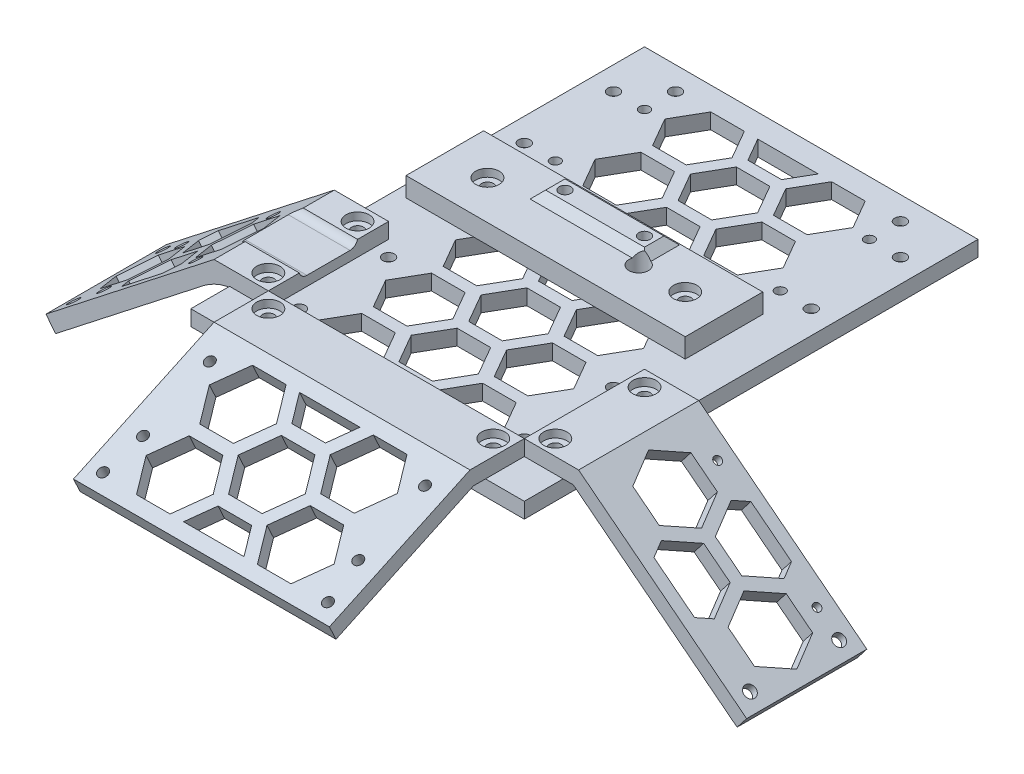
from build123d import *

# Parameters (mm, degrees)
SKETCH2_W            = 72
SKETCH2_H            = 20
BOSS_EXTRUDE1_DEPTH  = 5
SKETCH1_R            = 6
SKETCH1_R_2          = 3
BOSS_EXTRUDE2_DEPTH  = 4
SKETCH3_R            = 1.5
CUT_EXTRUDE1_DEPTH   = 39.431757701
SKETCH4_R            = 3
CUT_EXTRUDE2_DEPTH   = 2
SKETCH6_R            = 1.3
SKETCH6_R_2          = 1.5
BOSS_EXTRUDE4_DEPTH  = 4
SKETCH8_R            = 2.5
CUT_EXTRUDE3_DEPTH   = 74.042795675
SKETCH10_R           = 1.5
CUT_EXTRUDE4_DEPTH   = 5
BOSS_EXTRUDE6_START  = 2
SKETCH11_W           = 25.5
SKETCH11_H           = 5
SKETCH11_R           = 1.5
BOSS_EXTRUDE6_DEPTH  = 2
SKETCH12_R           = 3
CUT_EXTRUDE5_DEPTH   = 2
SKETCH14_R           = 2.983138595
CUT_EXTRUDE6_DEPTH   = 2
SKETCH15_W           = 14
SKETCH15_H           = 31
SKETCH15_R           = 1.5
BOSS_EXTRUDE7_DEPTH  = 4
BOSS_EXTRUDE8_DEPTH  = 31
SKETCH18_R           = 3
CUT_EXTRUDE7_DEPTH   = 2
SKETCH19_R           = 1.5
CUT_EXTRUDE8_DEPTH   = 111.725400051
SKETCH20_R           = 3
CUT_EXTRUDE9_DEPTH   = 2
SKETCH21_W           = 66
SKETCH21_H           = 14
SKETCH21_R           = 1.5
BOSS_EXTRUDE9_DEPTH  = 4
SKETCH22_R           = 3
CUT_EXTRUDE10_DEPTH  = 2
BOSS_EXTRUDE10_DEPTH = 66
SKETCH25_W           = 57.340591448
SKETCH25_H           = 15
CUT_EXTRUDE11_DEPTH  = 1.5
FILLET1_R            = 2
FILLET2_R            = 15
SKETCH28_R           = 1.25
CUT_EXTRUDE12_DEPTH  = 4
CUT_EXTRUDE13_DEPTH  = 4
SKETCH30_W           = 14
SKETCH30_H           = 31
SKETCH30_R           = 1.5
BOSS_EXTRUDE11_DEPTH = 4
BOSS_EXTRUDE12_DEPTH = 31
SKETCH32_R           = 1.5
SKETCH32_R_2         = 1
CUT_EXTRUDE14_DEPTH  = 4
CUT_EXTRUDE15_DEPTH  = 4
SKETCH34_R           = 3
SKETCH34_R_2         = 2.5
CUT_EXTRUDE16_DEPTH  = 2
CUT_EXTRUDE17_DEPTH  = 4
CUT_EXTRUDE18_DEPTH  = 4
SKETCH37_R           = 3
CUT_EXTRUDE19_DEPTH  = 2


with BuildPart() as part:
    # Sketch2 → Boss-Extrude1 (new body)
    with BuildSketch(Plane(origin=(0, 0, 0), x_dir=(1, 0, 0), z_dir=(0, 1, 0))):
        Rectangle(SKETCH2_W, SKETCH2_H)
    extrude(amount=BOSS_EXTRUDE1_DEPTH)

    # Sketch1 → Boss-Extrude2 (add)
    with BuildSketch(Plane(origin=(0, 0, 0), x_dir=(1, 0, 0), z_dir=(0, 1, 0))):
        with Locations(Location((-25, 0, 0), (0, 0, 270))):
            Circle(SKETCH1_R)
        with Locations(Location((26, 0, 0), (0, 0, 270))):
            Circle(SKETCH1_R_2)
    extrude(amount=-BOSS_EXTRUDE2_DEPTH)

    # Sketch3 → Cut-Extrude1 (cut, through all)
    with BuildSketch(Plane.XZ.offset(4)):
        with Locations(Location((-25, 0, 0), (0, 0, 270))):
            Circle(SKETCH3_R)
        with Locations(Location((26, 0, 0), (0, 0, 270))):
            Circle(SKETCH3_R)
    extrude(amount=-CUT_EXTRUDE1_DEPTH, mode=Mode.SUBTRACT)

    # Sketch4 → Cut-Extrude2 (cut)
    with BuildSketch(Plane(origin=(0, 5, 0), x_dir=(1, 0, 0), z_dir=(0, 1, 0))):
        with Locations(Location((-25, 0, 0), (0, 0, 270))):
            Circle(SKETCH4_R)
        with Locations(Location((26, 0, 0), (0, 0, 270))):
            Circle(SKETCH4_R)
    extrude(amount=-CUT_EXTRUDE2_DEPTH, mode=Mode.SUBTRACT)

    # Sketch8 → Cut-Extrude3 (cut, through all)
    with BuildSketch(Plane.XZ):
        with Locations(Location((14, 0, 0), (0, 0, 270))):
            Circle(SKETCH8_R)
    extrude(amount=-CUT_EXTRUDE3_DEPTH, mode=Mode.SUBTRACT)

    # Sketch10 → Cut-Extrude4 (cut)
    with BuildSketch(Plane(origin=(0, 5, 0), x_dir=(1, 0, 0), z_dir=(0, 1, 0))):
        with Locations(Location((-10.25, 5.25, 0), (0, 0, 270))):
            Circle(SKETCH10_R)
        with Locations(Location((10.25, 5.25, 0), (0, 0, 270))):
            Circle(SKETCH10_R)
    extrude(amount=-CUT_EXTRUDE4_DEPTH, mode=Mode.SUBTRACT)

    # Sketch11 → Boss-Extrude6 (add)
    with BuildSketch(Plane(origin=(0, 5, 0), x_dir=(1, 0, 0), z_dir=(0, 1, 0)).offset(BOSS_EXTRUDE6_START)):
        with Locations((0, 5.25)):
            Rectangle(SKETCH11_W, SKETCH11_H)
        with Locations(Location((-10.25, 5.25, 0), (0, 0, 270))):
            Circle(SKETCH11_R, mode=Mode.SUBTRACT)
        with Locations(Location((10.25, 5.25, 0), (0, 0, 270))):
            Circle(SKETCH11_R, mode=Mode.SUBTRACT)
    extrude(amount=-BOSS_EXTRUDE6_DEPTH)

    # Chamfer2
    # the kernel refuses this chamfer: 2 mm, written as the material it adds along each edge
    with BuildSketch(Plane(origin=(-12.75, 5, -2.75), x_dir=(0, -0.027495876610586487, 0.9996219169112968), z_dir=(1, 0, 0))) as chamfer2_piece_1_section:
        with BuildLine():
            Line((2.05734639, 0), (-0.11309431, -2.054235587))
            Line((-0.11309431, -2.054235587), (-0.153079186, -2.053135752))
            ThreePointArc((-0.153079186, -2.053135752), (-0.068258454, -1.026795659), (-0.039984877, 0.001099835))
            Line((-0.039984877, 0.001099835), (0.001099835, 0.039984877))
            ThreePointArc((0.001099835, 0.039984877), (1.028995329, 0.011711299), (2.058446225, 0.039984877))
            Line((2.058446225, 0.039984877), (2.05734639, 0))
        make_face()
    chamfer2_piece_1 = extrude(amount=25.5, mode=Mode.PRIVATE)
    chamfer2_piece_1 = chamfer2_piece_1 - Plane(origin=(14, 5.660762518, 0), x_dir=(0, 0, -1), z_dir=(0, -1, 0)) * Cylinder(2.5, 60, mode=Mode.PRIVATE)
    chamfer2_piece_1 = split(chamfer2_piece_1, bisect_by=Plane(origin=(-0.134065272, 7, -2.095887334), z_dir=(0, -1, 0)), keep=Keep.TOP, mode=Mode.PRIVATE)
    add(chamfer2_piece_1)
    with BuildSketch(Plane(origin=(12.75, 5, -2.75), x_dir=(0.9996219169112968, -0.027495876610586487, 0), z_dir=(0, 0, -1))) as chamfer2_piece_2_section:
        with BuildLine():
            Line((2.05734639, 0), (-0.11309431, -2.054235587))
            Line((-0.11309431, -2.054235587), (-0.153079186, -2.053135752))
            ThreePointArc((-0.153079186, -2.053135752), (-0.068258454, -1.026795659), (-0.039984877, 0.001099835))
            Line((-0.039984877, 0.001099835), (0.001099835, 0.039984877))
            ThreePointArc((0.001099835, 0.039984877), (1.028995329, 0.011711299), (2.058446225, 0.039984877))
            Line((2.058446225, 0.039984877), (2.05734639, 0))
        make_face()
    chamfer2_piece_2 = extrude(amount=5, mode=Mode.PRIVATE)
    chamfer2_piece_2 = split(chamfer2_piece_2, bisect_by=Plane(origin=(13.410808309, 7, -5.25), z_dir=(0, -1, 0)), keep=Keep.TOP, mode=Mode.PRIVATE)
    add(chamfer2_piece_2)
    with BuildSketch(Plane(origin=(12.75, 5, -7.75), x_dir=(0, -0.027495876610586487, -0.9996219169112968), z_dir=(-1, 0, 0))) as chamfer2_piece_3_section:
        with BuildLine():
            Line((2.05734639, 0), (-0.11309431, -2.054235587))
            Line((-0.11309431, -2.054235587), (-0.153079186, -2.053135752))
            ThreePointArc((-0.153079186, -2.053135752), (-0.068258454, -1.026795659), (-0.039984877, 0.001099835))
            Line((-0.039984877, 0.001099835), (0.001099835, 0.039984877))
            ThreePointArc((0.001099835, 0.039984877), (1.028995329, 0.011711299), (2.058446225, 0.039984877))
            Line((2.058446225, 0.039984877), (2.05734639, 0))
        make_face()
    chamfer2_piece_3 = extrude(amount=25.5, mode=Mode.PRIVATE)
    chamfer2_piece_3 = split(chamfer2_piece_3, bisect_by=Plane(origin=(0, 7, -8.410808309), z_dir=(0, -1, 0)), keep=Keep.TOP, mode=Mode.PRIVATE)
    add(chamfer2_piece_3)
    with BuildSketch(Plane(origin=(-12.75, 5, -7.75), x_dir=(-0.9996219169112968, -0.027495876610586487, 0), z_dir=(0, 0, 1))) as chamfer2_piece_4_section:
        with BuildLine():
            Line((2.05734639, 0), (-0.11309431, -2.054235587))
            Line((-0.11309431, -2.054235587), (-0.153079186, -2.053135752))
            ThreePointArc((-0.153079186, -2.053135752), (-0.068258454, -1.026795659), (-0.039984877, 0.001099835))
            Line((-0.039984877, 0.001099835), (0.001099835, 0.039984877))
            ThreePointArc((0.001099835, 0.039984877), (1.028995329, 0.011711299), (2.058446225, 0.039984877))
            Line((2.058446225, 0.039984877), (2.05734639, 0))
        make_face()
    chamfer2_piece_4 = extrude(amount=5, mode=Mode.PRIVATE)
    chamfer2_piece_4 = split(chamfer2_piece_4, bisect_by=Plane(origin=(-13.410808309, 7, -5.25), z_dir=(0, -1, 0)), keep=Keep.TOP, mode=Mode.PRIVATE)
    add(chamfer2_piece_4)
    with BuildSketch(Plane(origin=(-12.75, 5, -7.75), x_dir=(-0.9996219169112968, -0.027495876610586487, 0), z_dir=(0, 0, 1))) as chamfer2_piece_5a_section:
        with BuildLine():
            Line((2.05734639, 0), (-0.11309431, -2.054235587))
            Line((-0.11309431, -2.054235587), (-0.153079186, -2.053135752))
            ThreePointArc((-0.153079186, -2.053135752), (-0.068258454, -1.026795659), (-0.039984877, 0.001099835))
            Line((-0.039984877, 0.001099835), (0.001099835, 0.039984877))
            ThreePointArc((0.001099835, 0.039984877), (1.028995329, 0.011711299), (2.058446225, 0.039984877))
            Line((2.058446225, 0.039984877), (2.05734639, 0))
        make_face()
    chamfer2_piece_5a = extrude(amount=7.05734639, mode=Mode.PRIVATE)
    chamfer2_piece_5a = split(chamfer2_piece_5a, bisect_by=Plane(origin=(-13.410808309, 7, -1.721326805), z_dir=(0, -1, 0)), keep=Keep.TOP, mode=Mode.PRIVATE)
    chamfer2_piece_5a = split(chamfer2_piece_5a, bisect_by=Plane(origin=(-13.410808309, 5.657268668, -2.75), z_dir=(0, 0, 1)), keep=Keep.TOP, mode=Mode.PRIVATE)
    with BuildSketch(Plane(origin=(-14.80734639, 5, -2.75), x_dir=(0, -0.027495876610586487, 0.9996219169112968), z_dir=(1, 0, 0))) as chamfer2_piece_5b_section:
        with BuildLine():
            Line((2.05734639, 0), (-0.11309431, -2.054235587))
            Line((-0.11309431, -2.054235587), (-0.153079186, -2.053135752))
            ThreePointArc((-0.153079186, -2.053135752), (-0.068258454, -1.026795659), (-0.039984877, 0.001099835))
            Line((-0.039984877, 0.001099835), (0.001099835, 0.039984877))
            ThreePointArc((0.001099835, 0.039984877), (1.028995329, 0.011711299), (2.058446225, 0.039984877))
            Line((2.058446225, 0.039984877), (2.05734639, 0))
        make_face()
    chamfer2_piece_5b = extrude(amount=27.55734639, mode=Mode.PRIVATE)
    chamfer2_piece_5b = split(chamfer2_piece_5b, bisect_by=Plane(origin=(-13.778673195, 7, -2.089191691), z_dir=(0, -1, 0)), keep=Keep.TOP, mode=Mode.PRIVATE)
    chamfer2_piece_5b = split(chamfer2_piece_5b, bisect_by=Plane(origin=(-12.75, 5.657268668, -2.089191691), z_dir=(-1, 0, 0)), keep=Keep.TOP, mode=Mode.PRIVATE)
    chamfer2_piece_5 = chamfer2_piece_5a & chamfer2_piece_5b
    add(chamfer2_piece_5)
    with BuildSketch(Plane(origin=(-12.75, 5, -2.75), x_dir=(0, -0.027495876610586487, 0.9996219169112968), z_dir=(1, 0, 0))) as chamfer2_piece_6a_section:
        with BuildLine():
            Line((2.05734639, 0), (-0.11309431, -2.054235587))
            Line((-0.11309431, -2.054235587), (-0.153079186, -2.053135752))
            ThreePointArc((-0.153079186, -2.053135752), (-0.068258454, -1.026795659), (-0.039984877, 0.001099835))
            Line((-0.039984877, 0.001099835), (0.001099835, 0.039984877))
            ThreePointArc((0.001099835, 0.039984877), (1.028995329, 0.011711299), (2.058446225, 0.039984877))
            Line((2.058446225, 0.039984877), (2.05734639, 0))
        make_face()
    chamfer2_piece_6a = extrude(amount=27.55734639, mode=Mode.PRIVATE)
    chamfer2_piece_6a = chamfer2_piece_6a - Plane(origin=(14, 5.933617383, 0), x_dir=(0, 0, -1), z_dir=(0, -1, 0)) * Cylinder(2.5, 64, mode=Mode.PRIVATE)
    chamfer2_piece_6a = split(chamfer2_piece_6a, bisect_by=Plane(origin=(13.702845422, 7, -2.606312664), z_dir=(0, -1, 0)), keep=Keep.TOP, mode=Mode.PRIVATE)
    chamfer2_piece_6a = split(chamfer2_piece_6a, bisect_by=Plane(origin=(12.75, 5.933617383, -2.606312664), z_dir=(1, 0, 0)), keep=Keep.TOP, mode=Mode.PRIVATE)
    with BuildSketch(Plane(origin=(12.75, 5, -0.69265361), x_dir=(0.9996219169112968, -0.027495876610586487, 0), z_dir=(0, 0, -1))) as chamfer2_piece_6b_section:
        with BuildLine():
            Line((2.05734639, 0), (-0.11309431, -2.054235587))
            Line((-0.11309431, -2.054235587), (-0.153079186, -2.053135752))
            ThreePointArc((-0.153079186, -2.053135752), (-0.068258454, -1.026795659), (-0.039984877, 0.001099835))
            Line((-0.039984877, 0.001099835), (0.001099835, 0.039984877))
            ThreePointArc((0.001099835, 0.039984877), (1.028995329, 0.011711299), (2.058446225, 0.039984877))
            Line((2.058446225, 0.039984877), (2.05734639, 0))
        make_face()
    chamfer2_piece_6b = extrude(amount=7.05734639, mode=Mode.PRIVATE)
    chamfer2_piece_6b = chamfer2_piece_6b - Plane(origin=(14, 5.726450415, 0), x_dir=(0, 0, -1), z_dir=(0, -1, 0)) * Cylinder(2.5, 23, mode=Mode.PRIVATE)
    chamfer2_piece_6b = split(chamfer2_piece_6b, bisect_by=Plane(origin=(13.28343187, 7, -2.545767831), z_dir=(0, -1, 0)), keep=Keep.TOP, mode=Mode.PRIVATE)
    chamfer2_piece_6b = split(chamfer2_piece_6b, bisect_by=Plane(origin=(13.28343187, 5.726450415, -2.75), z_dir=(0, 0, 1)), keep=Keep.TOP, mode=Mode.PRIVATE)
    chamfer2_piece_6 = chamfer2_piece_6a & chamfer2_piece_6b
    add(chamfer2_piece_6)
    with BuildSketch(Plane(origin=(12.75, 5, -2.75), x_dir=(0.9996219169112968, -0.027495876610586487, 0), z_dir=(0, 0, -1))) as chamfer2_piece_7a_section:
        with BuildLine():
            Line((2.05734639, 0), (-0.11309431, -2.054235587))
            Line((-0.11309431, -2.054235587), (-0.153079186, -2.053135752))
            ThreePointArc((-0.153079186, -2.053135752), (-0.068258454, -1.026795659), (-0.039984877, 0.001099835))
            Line((-0.039984877, 0.001099835), (0.001099835, 0.039984877))
            ThreePointArc((0.001099835, 0.039984877), (1.028995329, 0.011711299), (2.058446225, 0.039984877))
            Line((2.058446225, 0.039984877), (2.05734639, 0))
        make_face()
    chamfer2_piece_7a = extrude(amount=7.05734639, mode=Mode.PRIVATE)
    chamfer2_piece_7a = split(chamfer2_piece_7a, bisect_by=Plane(origin=(13.410808309, 5.657268668, -7.75), z_dir=(0, 0, -1)), keep=Keep.TOP, mode=Mode.PRIVATE)
    chamfer2_piece_7a = split(chamfer2_piece_7a, bisect_by=Plane(origin=(13.410808309, 7, -8.778673195), z_dir=(0, -1, 0)), keep=Keep.TOP, mode=Mode.PRIVATE)
    with BuildSketch(Plane(origin=(14.80734639, 5, -7.75), x_dir=(0, -0.027495876610586487, -0.9996219169112968), z_dir=(-1, 0, 0))) as chamfer2_piece_7b_section:
        with BuildLine():
            Line((2.05734639, 0), (-0.11309431, -2.054235587))
            Line((-0.11309431, -2.054235587), (-0.153079186, -2.053135752))
            ThreePointArc((-0.153079186, -2.053135752), (-0.068258454, -1.026795659), (-0.039984877, 0.001099835))
            Line((-0.039984877, 0.001099835), (0.001099835, 0.039984877))
            ThreePointArc((0.001099835, 0.039984877), (1.028995329, 0.011711299), (2.058446225, 0.039984877))
            Line((2.058446225, 0.039984877), (2.05734639, 0))
        make_face()
    chamfer2_piece_7b = extrude(amount=27.55734639, mode=Mode.PRIVATE)
    chamfer2_piece_7b = split(chamfer2_piece_7b, bisect_by=Plane(origin=(12.75, 5.657268668, -8.410808309), z_dir=(1, 0, 0)), keep=Keep.TOP, mode=Mode.PRIVATE)
    chamfer2_piece_7b = split(chamfer2_piece_7b, bisect_by=Plane(origin=(13.778673195, 7, -8.410808309), z_dir=(0, -1, 0)), keep=Keep.TOP, mode=Mode.PRIVATE)
    chamfer2_piece_7 = chamfer2_piece_7a & chamfer2_piece_7b
    add(chamfer2_piece_7)
    with BuildSketch(Plane(origin=(-12.75, 5, -9.80734639), x_dir=(-0.9996219169112968, -0.027495876610586487, 0), z_dir=(0, 0, 1))) as chamfer2_piece_8a_section:
        with BuildLine():
            Line((2.05734639, 0), (-0.11309431, -2.054235587))
            Line((-0.11309431, -2.054235587), (-0.153079186, -2.053135752))
            ThreePointArc((-0.153079186, -2.053135752), (-0.068258454, -1.026795659), (-0.039984877, 0.001099835))
            Line((-0.039984877, 0.001099835), (0.001099835, 0.039984877))
            ThreePointArc((0.001099835, 0.039984877), (1.028995329, 0.011711299), (2.058446225, 0.039984877))
            Line((2.058446225, 0.039984877), (2.05734639, 0))
        make_face()
    chamfer2_piece_8a = extrude(amount=7.05734639, mode=Mode.PRIVATE)
    chamfer2_piece_8a = split(chamfer2_piece_8a, bisect_by=Plane(origin=(-13.410808309, 5.657268668, -7.75), z_dir=(0, 0, -1)), keep=Keep.TOP, mode=Mode.PRIVATE)
    chamfer2_piece_8a = split(chamfer2_piece_8a, bisect_by=Plane(origin=(-13.410808309, 7, -8.778673195), z_dir=(0, -1, 0)), keep=Keep.TOP, mode=Mode.PRIVATE)
    with BuildSketch(Plane(origin=(12.75, 5, -7.75), x_dir=(0, -0.027495876610586487, -0.9996219169112968), z_dir=(-1, 0, 0))) as chamfer2_piece_8b_section:
        with BuildLine():
            Line((2.05734639, 0), (-0.11309431, -2.054235587))
            Line((-0.11309431, -2.054235587), (-0.153079186, -2.053135752))
            ThreePointArc((-0.153079186, -2.053135752), (-0.068258454, -1.026795659), (-0.039984877, 0.001099835))
            Line((-0.039984877, 0.001099835), (0.001099835, 0.039984877))
            ThreePointArc((0.001099835, 0.039984877), (1.028995329, 0.011711299), (2.058446225, 0.039984877))
            Line((2.058446225, 0.039984877), (2.05734639, 0))
        make_face()
    chamfer2_piece_8b = extrude(amount=27.55734639, mode=Mode.PRIVATE)
    chamfer2_piece_8b = split(chamfer2_piece_8b, bisect_by=Plane(origin=(-12.75, 5.657268668, -8.410808309), z_dir=(-1, 0, 0)), keep=Keep.TOP, mode=Mode.PRIVATE)
    chamfer2_piece_8b = split(chamfer2_piece_8b, bisect_by=Plane(origin=(-13.778673195, 7, -8.410808309), z_dir=(0, -1, 0)), keep=Keep.TOP, mode=Mode.PRIVATE)
    chamfer2_piece_8 = chamfer2_piece_8a & chamfer2_piece_8b
    add(chamfer2_piece_8)

    # Sketch12 → Cut-Extrude5 (cut)
    with BuildSketch(Plane.XZ):
        with Locations(Location((-10.25, -5.25, 0), (0, 0, 270))):
            Circle(SKETCH12_R)
        with Locations(Location((10.25, -5.25, 0), (0, 0, 270))):
            Circle(SKETCH12_R)
    extrude(amount=-CUT_EXTRUDE5_DEPTH, mode=Mode.SUBTRACT)


with BuildPart() as body_2:
    # Sketch6 → Boss-Extrude4 (new body)
    with BuildSketch(Plane.XZ.offset(4)):
        Polygon((-36, -58.5), (36, -58.5), (43, -58.5), (43, 58.5), (36, 58.5), (-36, 58.5), (-43, 58.5), (-43, -58.5), align=None)
        with Locations(Location((-29, -21.5, 0), (0, 0, 270))):
            Circle(SKETCH6_R, mode=Mode.SUBTRACT)
        with Locations(Location((-29, -44.5, 0), (0, 0, 270))):
            Circle(SKETCH6_R, mode=Mode.SUBTRACT)
        with Locations(Location((29, -44.5, 0), (0, 0, 90))):
            Circle(SKETCH6_R, mode=Mode.SUBTRACT)
        with Locations(Location((29, -21.5, 0), (0, 0, 90))):
            Circle(SKETCH6_R, mode=Mode.SUBTRACT)
        with Locations(Location((-25, 0, 0), (0, 0, 270))):
            Circle(SKETCH6_R_2, mode=Mode.SUBTRACT)
        with Locations(Location((26, 0, 0), (0, 0, 270))):
            Circle(SKETCH6_R_2, mode=Mode.SUBTRACT)
        with Locations(Location((-29, 44.5, 0), (0, 0, 270))):
            Circle(SKETCH6_R_2, mode=Mode.SUBTRACT)
        with Locations(Location((-29, 21.5, 0), (0, 0, 270))):
            Circle(SKETCH6_R_2, mode=Mode.SUBTRACT)
        with Locations(Location((29, 21.5, 0), (0, 0, 270))):
            Circle(SKETCH6_R_2, mode=Mode.SUBTRACT)
        with Locations(Location((29, 44.5, 0), (0, 0, 270))):
            Circle(SKETCH6_R_2, mode=Mode.SUBTRACT)
        with Locations(Location((-29, 52.5, 0), (0, 0, 270))):
            Circle(SKETCH6_R_2, mode=Mode.SUBTRACT)
        with Locations(Location((29, 52.5, 0), (0, 0, 90))):
            Circle(SKETCH6_R_2, mode=Mode.SUBTRACT)
        with Locations(Location((29, -52.5, 0), (0, 0, 270))):
            Circle(SKETCH6_R_2, mode=Mode.SUBTRACT)
        with Locations(Location((-29, -52.5, 0), (0, 0, 90))):
            Circle(SKETCH6_R_2, mode=Mode.SUBTRACT)
        with Locations(Location((-37, 44.5, 0), (0, 0, 270))):
            Circle(SKETCH6_R_2, mode=Mode.SUBTRACT)
        with Locations(Location((-37, 21.5, 0), (0, 0, 270))):
            Circle(SKETCH6_R_2, mode=Mode.SUBTRACT)
        with Locations(Location((37, 44.5, 0), (0, 0, 90))):
            Circle(SKETCH6_R_2, mode=Mode.SUBTRACT)
        with Locations(Location((37, 21.5, 0), (0, 0, 90))):
            Circle(SKETCH6_R_2, mode=Mode.SUBTRACT)
        with Locations(Location((37, -44.5, 0), (0, 0, 270))):
            Circle(SKETCH6_R_2, mode=Mode.SUBTRACT)
        with Locations(Location((37, -21.5, 0), (0, 0, 270))):
            Circle(SKETCH6_R_2, mode=Mode.SUBTRACT)
        with Locations(Location((-37, -21.5, 0), (0, 0, 90))):
            Circle(SKETCH6_R_2, mode=Mode.SUBTRACT)
        with Locations(Location((-37, -44.5, 0), (0, 0, 90))):
            Circle(SKETCH6_R_2, mode=Mode.SUBTRACT)
    extrude(amount=BOSS_EXTRUDE4_DEPTH)

    # Sketch14 → Cut-Extrude6 (cut)
    with BuildSketch(Plane.XZ.offset(8)):
        with Locations(Location((-25, 0, 0), (0, 0, 270))):
            Circle(SKETCH14_R)
        with Locations(Location((26, 0, 0), (0, 0, 270))):
            Circle(SKETCH14_R)
        with BuildLine():
            Line((-37, 47.483138595), (-31.983138595, 47.483138595))
            Line((-31.983138595, 47.483138595), (-31.983138595, 52.5))
            ThreePointArc((-31.983138595, 52.5), (-29, 55.483138595), (-26.016861405, 52.5))
            Line((-26.016861405, 52.5), (-26.016861405, 44.5))
            ThreePointArc((-26.016861405, 44.5), (-26.89060247, 42.39060247), (-29, 41.516861405))
            Line((-29, 41.516861405), (-37, 41.516861405))
            ThreePointArc((-37, 41.516861405), (-39.983138595, 44.5), (-37, 47.483138595))
        make_face()
        with BuildLine():
            Line((-37, 24.483138595), (-29, 24.483138595))
            ThreePointArc((-29, 24.483138595), (-26.016861405, 21.5), (-29, 18.516861405))
            Line((-29, 18.516861405), (-37, 18.516861405))
            ThreePointArc((-37, 18.516861405), (-39.983138595, 21.5), (-37, 24.483138595))
        make_face()
        with BuildLine():
            Line((37, 18.516861405), (29, 18.516861405))
            ThreePointArc((29, 18.516861405), (26.016861405, 21.5), (29, 24.483138595))
            Line((29, 24.483138595), (37, 24.483138595))
            ThreePointArc((37, 24.483138595), (39.983138595, 21.5), (37, 18.516861405))
        make_face()
        with BuildLine():
            Line((26.016861405, 44.5), (26.016861405, 52.5))
            ThreePointArc((26.016861405, 52.5), (29, 55.483138595), (31.983138595, 52.5))
            Line((31.983138595, 52.5), (31.983138595, 47.483138595))
            Line((31.983138595, 47.483138595), (37, 47.483138595))
            ThreePointArc((37, 47.483138595), (39.983138595, 44.5), (37, 41.516861405))
            Line((37, 41.516861405), (29, 41.516861405))
            ThreePointArc((29, 41.516861405), (26.89060247, 42.39060247), (26.016861405, 44.5))
        make_face()
        with BuildLine():
            Line((37, -47.483138595), (31.983138595, -47.483138595))
            Line((31.983138595, -47.483138595), (31.983138595, -52.5))
            ThreePointArc((31.983138595, -52.5), (29, -55.483138595), (26.016861405, -52.5))
            Line((26.016861405, -52.5), (26.016861405, -44.5))
            ThreePointArc((26.016861405, -44.5), (26.89060247, -42.39060247), (29, -41.516861405))
            Line((29, -41.516861405), (37, -41.516861405))
            ThreePointArc((37, -41.516861405), (39.983138595, -44.5), (37, -47.483138595))
        make_face()
        with BuildLine():
            Line((37, -24.483138595), (29, -24.483138595))
            ThreePointArc((29, -24.483138595), (26.016861405, -21.5), (29, -18.516861405))
            Line((29, -18.516861405), (37, -18.516861405))
            ThreePointArc((37, -18.516861405), (39.983138595, -21.5), (37, -24.483138595))
        make_face()
        with BuildLine():
            Line((-37, -18.516861405), (-29, -18.516861405))
            ThreePointArc((-29, -18.516861405), (-26.016861405, -21.5), (-29, -24.483138595))
            Line((-29, -24.483138595), (-37, -24.483138595))
            ThreePointArc((-37, -24.483138595), (-39.983138595, -21.5), (-37, -18.516861405))
        make_face()
        with BuildLine():
            Line((-26.016861405, -44.5), (-26.016861405, -52.5))
            ThreePointArc((-26.016861405, -52.5), (-29, -55.483138595), (-31.983138595, -52.5))
            Line((-31.983138595, -52.5), (-31.983138595, -47.483138595))
            Line((-31.983138595, -47.483138595), (-37, -47.483138595))
            ThreePointArc((-37, -47.483138595), (-39.983138595, -44.5), (-37, -41.516861405))
            Line((-37, -41.516861405), (-29, -41.516861405))
            ThreePointArc((-29, -41.516861405), (-26.89060247, -42.39060247), (-26.016861405, -44.5))
        make_face()
    extrude(amount=-CUT_EXTRUDE6_DEPTH, mode=Mode.SUBTRACT)

    # Sketch36 → Cut-Extrude18 (cut)
    with BuildSketch(Plane(origin=(0, -4, 0), x_dir=(1, 0, 0), z_dir=(0, 1, 0))):
        Polygon((-19.918584287, -52.5), (-11.258330249, -52.5), (-6.92820323, -45), (-11.258330249, -37.5), (-19.918584287, -37.5), (-24.248711306, -45), align=None)
        Polygon((-7.794228634, -52.5), (7.794228634, -52.5), (4.330127019, -46.5), (-4.330127019, -46.5), align=None)
        Polygon((11.258330249, -52.5), (19.918584287, -52.5), (24.248711306, -45), (19.918584287, -37.5), (11.258330249, -37.5), (6.92820323, -45), align=None)
        Polygon((-4.330127019, -43.5), (4.330127019, -43.5), (8.660254038, -36), (4.330127019, -28.5), (-4.330127019, -28.5), (-8.660254038, -36), align=None)
        Polygon((-19.918584287, -34.5), (-11.258330249, -34.5), (-6.92820323, -27), (-11.258330249, -19.5), (-19.918584287, -19.5), (-24.248711306, -27), align=None)
        Polygon((-4.330127019, -25.5), (4.330127019, -25.5), (8.660254038, -18), (4.330127019, -10.5), (-4.330127019, -10.5), (-8.660254038, -18), align=None)
        Polygon((11.258330249, -34.5), (19.918584287, -34.5), (24.248711306, -27), (19.918584287, -19.5), (11.258330249, -19.5), (6.92820323, -27), align=None)
        Polygon((11.258330249, -16.5), (19.918584287, -16.5), (24.248711306, -9), (19.918584287, -1.5), (11.258330249, -1.5), (6.92820323, -9), align=None)
        Polygon((-4.330127019, -7.5), (4.330127019, -7.5), (8.660254038, 0), (4.330127019, 7.5), (-4.330127019, 7.5), (-8.660254038, 0), align=None)
        Polygon((-19.918584287, -16.5), (-11.258330249, -16.5), (-6.92820323, -9), (-11.258330249, -1.5), (-19.918584287, -1.5), (-24.248711306, -9), align=None)
        Polygon((-19.918584287, 1.5), (-11.258330249, 1.5), (-6.92820323, 9), (-11.258330249, 16.5), (-19.918584287, 16.5), (-24.248711306, 9), align=None)
        Polygon((11.258330249, 1.5), (19.918584287, 1.5), (24.248711306, 9), (19.918584287, 16.5), (11.258330249, 16.5), (6.92820323, 9), align=None)
        Polygon((-4.330127019, 10.5), (4.330127019, 10.5), (8.660254038, 18), (4.330127019, 25.5), (-4.330127019, 25.5), (-8.660254038, 18), align=None)
        Polygon((11.258330249, 19.5), (19.918584287, 19.5), (24.248711306, 27), (19.918584287, 34.5), (11.258330249, 34.5), (6.92820323, 27), align=None)
        Polygon((-19.918584287, 19.5), (-11.258330249, 19.5), (-6.92820323, 27), (-11.258330249, 34.5), (-19.918584287, 34.5), (-24.248711306, 27), align=None)
        Polygon((-4.330127019, 28.5), (4.330127019, 28.5), (8.660254038, 36), (4.330127019, 43.5), (-4.330127019, 43.5), (-8.660254038, 36), align=None)
        Polygon((-19.918584287, 37.5), (-11.258330249, 37.5), (-6.92820323, 45), (-11.258330249, 52.5), (-19.918584287, 52.5), (-24.248711306, 45), align=None)
        Polygon((4.330127019, 46.5), (7.794228634, 52.5), (-7.794228634, 52.5), (-4.330127019, 46.5), align=None)
        Polygon((11.258330249, 37.5), (19.918584287, 37.5), (24.248711306, 45), (19.918584287, 52.5), (11.258330249, 52.5), (6.92820323, 45), align=None)
    extrude(amount=-CUT_EXTRUDE18_DEPTH, mode=Mode.SUBTRACT)


with BuildPart() as body_3:
    # Sketch15 → Boss-Extrude7 (new body)
    with BuildSketch(Plane(origin=(0, -4, 0), x_dir=(1, 0, 0), z_dir=(0, 1, 0))):
        with Locations((-40, -33)):
            Rectangle(SKETCH15_W, SKETCH15_H)
        with Locations(Location((-37, -21.5, 0), (0, 0, 270))):
            Circle(SKETCH15_R, mode=Mode.SUBTRACT)
        with Locations(Location((-37, -44.5, 0), (0, 0, 270))):
            Circle(SKETCH15_R, mode=Mode.SUBTRACT)
    extrude(amount=BOSS_EXTRUDE7_DEPTH)

    # Sketch17 → Boss-Extrude8 (add)
    with BuildSketch(Plane.XY.offset(48.5)):
        Polygon((-47, 0), (-90.340591448, -33.861381143), (-87.877945547, -37.013424157), (-45.622689547, -4), align=None)
    extrude(amount=-BOSS_EXTRUDE8_DEPTH)

    # Sketch18 → Cut-Extrude7 (cut)
    with BuildSketch(Plane(origin=(0, 0, 0), x_dir=(1, 0, 0), z_dir=(0, 1, 0))):
        with Locations(Location((-37, -21.5, 0), (0, 0, 270))):
            Circle(SKETCH18_R)
        with Locations(Location((-37, -44.5, 0), (0, 0, 270))):
            Circle(SKETCH18_R)
    extrude(amount=-CUT_EXTRUDE7_DEPTH, mode=Mode.SUBTRACT)

    # Sketch19 → Cut-Extrude8 (cut, through all)
    with BuildSketch(Plane(origin=(-17.814835453, 22.801949567, 0), x_dir=(0.7880107536067209, 0.6156614753256597, 0), z_dir=(-0.6156614753256597, 0.7880107536067209, 0))):
        with Locations(Location((-50.03650542, -23, 0), (0, 0, 180))):
            Circle(SKETCH19_R)
        with Locations(Location((-50.03650542, -43, 0), (0, 0, 180))):
            Circle(SKETCH19_R)
        with Locations(Location((-80.03650542, -43, 0), (0, 0, 180))):
            Circle(SKETCH19_R)
        with Locations(Location((-80.03650542, -23, 0), (0, 0, 180))):
            Circle(SKETCH19_R)
        with Locations(Location((-88.03650542, -21.5, 0), (0, 0, 180))):
            Circle(SKETCH19_R)
        with Locations(Location((-88.03650542, -44.5, 0), (0, 0, 180))):
            Circle(SKETCH19_R)
    extrude(amount=-CUT_EXTRUDE8_DEPTH, mode=Mode.SUBTRACT)

    # Sketch20 → Cut-Extrude9 (cut)
    with BuildSketch(Plane(origin=(-15.352189552, 19.649906553, 0), x_dir=(0.7880107536067208, 0.6156614753256597, 0), z_dir=(0.6156614753256597, -0.7880107536067208, 0))):
        with Locations((-50.03650542, 43)):
            Circle(SKETCH20_R)
        with Locations((-50.03650542, 23)):
            Circle(SKETCH20_R)
        with BuildLine():
            Line((-88.589371025, 24.448616561), (-80.589371025, 25.948616561))
            ThreePointArc((-80.589371025, 25.948616561), (-77.087888859, 23.552865605), (-79.483639814, 20.051383439))
            Line((-79.483639814, 20.051383439), (-87.483639814, 18.551383439))
            ThreePointArc((-87.483639814, 18.551383439), (-90.98512198, 20.947134395), (-88.589371025, 24.448616561))
        make_face()
        with BuildLine():
            Line((-88.589371025, 41.551383439), (-80.589371025, 40.051383439))
            ThreePointArc((-80.589371025, 40.051383439), (-77.087888859, 42.447134395), (-79.483639814, 45.948616561))
            Line((-79.483639814, 45.948616561), (-87.483639814, 47.448616561))
            ThreePointArc((-87.483639814, 47.448616561), (-90.98512198, 45.052865605), (-88.589371025, 41.551383439))
        make_face()
    extrude(amount=-CUT_EXTRUDE9_DEPTH, mode=Mode.SUBTRACT)

    # Sketch25 → Cut-Extrude11 (cut)
    with BuildSketch(Plane(origin=(0, 0, 0), x_dir=(1, 0, 0), z_dir=(0, 1, 0))):
        with Locations((-61.670295724, -33)):
            Rectangle(SKETCH25_W, SKETCH25_H)
    extrude(amount=-CUT_EXTRUDE11_DEPTH, mode=Mode.SUBTRACT)

    # Fillet1
    # the kernel refuses this fillet: 2 mm, written as the material it adds along each edge
    with BuildSketch(Plane(origin=(-53.761141631, -1.5, 40.5), x_dir=(0, 1, 0), z_dir=(1, 0, 0))) as fillet1_piece_1_section:
        with BuildLine():
            CenterArc((2, -1.936491673), FILLET1_R, 104.477512186, 75.522487814)
            Line((0, -1.936491673), (-0.04, -1.936491673))
            Line((-0.04, -1.936491673), (-0.04, 0))
            Line((-0.04, 0), (0, 0.04))
            ThreePointArc((0, 0.04), (0.75, 0.04), (1.49, 0.038729833))
            Line((1.49, 0.038729833), (1.5, 0))
        make_face()
    fillet1_piece_1 = extrude(amount=20.761141631, mode=Mode.PRIVATE)
    fillet1_piece_1 = split(fillet1_piece_1, bisect_by=Plane(origin=(-43.65137647, 2.616231433, 40.036498943), z_dir=(0.6156614753256596, -0.7880107536067209, 0)), keep=Keep.TOP, mode=Mode.PRIVATE)
    add(fillet1_piece_1)
    with BuildSketch(Plane(origin=(-33, -1.5, 25.5), x_dir=(0, 0, 1), z_dir=(-1, 0, 0))) as fillet1_piece_2_section:
        with BuildLine():
            CenterArc((1.936491673, 2), FILLET1_R, 194.477512186, 75.522487814)
            Line((0, 1.5), (-0.038729833, 1.49))
            ThreePointArc((-0.038729833, 1.49), (-0.04, 0.75), (-0.04, 0))
            Line((-0.04, 0), (0, -0.04))
            Line((0, -0.04), (1.936491673, -0.04))
            Line((1.936491673, -0.04), (1.936491673, 0))
        make_face()
    fillet1_piece_2 = extrude(amount=20.761141631, mode=Mode.PRIVATE)
    fillet1_piece_2 = split(fillet1_piece_2, bisect_by=Plane(origin=(-43.65137647, 2.616231433, 25.963501057), z_dir=(0.6156614753256596, -0.7880107536067209, 0)), keep=Keep.TOP, mode=Mode.PRIVATE)
    add(fillet1_piece_2)

    # Fillet2
    fillet2_edges = [body_3.edges().sort_by_distance(p)[0] for p in [
        (-45.622689547, -4, 33),
    ]]
    fillet(fillet2_edges, radius=FILLET2_R)

    # Sketch35 → Cut-Extrude17 (cut)
    with BuildSketch(Plane(origin=(-17.814835453, 22.801949567, 0), x_dir=(0.7880107536067209, 0.6156614753256597, 0), z_dir=(-0.6156614753256597, 0.7880107536067209, 0))):
        Polygon((-55.876251382, -24), (-57.896977324, -20.5), (-71.176033515, -20.5), (-73.196759457, -24), (-68.866632438, -31.5), (-60.206378401, -31.5), align=None)
        Polygon((-40.287794114, -33), (-44.617921132, -25.5), (-53.27817517, -25.5), (-57.608302189, -33), (-53.27817517, -40.5), (-44.617921132, -40.5), align=None)
        Polygon((-71.46470865, -33), (-75.794835669, -25.5), (-84.455089707, -25.5), (-88.785216725, -33), (-84.455089707, -40.5), (-75.794835669, -40.5), align=None)
        Polygon((-55.876251382, -42), (-60.206378401, -34.5), (-68.866632438, -34.5), (-73.196759457, -42), (-71.176033515, -45.5), (-57.896977324, -45.5), align=None)
    extrude(amount=-CUT_EXTRUDE17_DEPTH, mode=Mode.SUBTRACT)


with BuildPart() as body_4:
    # Sketch21 → Boss-Extrude9 (new body)
    with BuildSketch(Plane(origin=(0, -4, 0), x_dir=(1, 0, 0), z_dir=(0, 1, 0))):
        with Locations((0, -55.5)):
            Rectangle(SKETCH21_W, SKETCH21_H)
        with Locations(Location((-29, -52.5, 0), (0, 0, 270))):
            Circle(SKETCH21_R, mode=Mode.SUBTRACT)
        with Locations(Location((29, -52.5, 0), (0, 0, 270))):
            Circle(SKETCH21_R, mode=Mode.SUBTRACT)
    extrude(amount=BOSS_EXTRUDE9_DEPTH)

    # Sketch22 → Cut-Extrude10 (cut)
    with BuildSketch(Plane(origin=(0, 0, 0), x_dir=(1, 0, 0), z_dir=(0, 1, 0))):
        with Locations(Location((-29, -52.5, 0), (0, 0, 270))):
            Circle(SKETCH22_R)
        with Locations(Location((29, -52.5, 0), (0, 0, 270))):
            Circle(SKETCH22_R)
    extrude(amount=-CUT_EXTRUDE10_DEPTH, mode=Mode.SUBTRACT)

    # Sketch23 → Boss-Extrude10 (add)
    with BuildSketch(Plane.ZY.offset(33)):
        Polygon((62.5, 0), (98.752311481, -16.90473047), (97.061838435, -20.529961618), (61.613221349, -4), align=None)
    extrude(amount=-BOSS_EXTRUDE10_DEPTH)

    # Sketch28 → Cut-Extrude12 (cut)
    with BuildSketch(Plane(origin=(0, 23.938888847, 11.162887197), x_dir=(1, 0, 0), z_dir=(0, 0.9063077870366527, 0.42261826174069383))):
        with Locations(Location((-29, -92.64423669, 0), (0, 0, 270))):
            Circle(SKETCH28_R)
        with Locations(Location((29, -92.64423669, 0), (0, 0, 90))):
            Circle(SKETCH28_R)
        with Locations(Location((-27.75, -63.64423669, 0), (0, 0, 270))):
            Circle(SKETCH28_R)
        with Locations(Location((-27.75, -82.64423669, 0), (0, 0, 270))):
            Circle(SKETCH28_R)
        with Locations(Location((27.75, -82.64423669, 0), (0, 0, 270))):
            Circle(SKETCH28_R)
        with Locations(Location((27.75, -63.64423669, 0), (0, 0, 270))):
            Circle(SKETCH28_R)
    extrude(amount=-CUT_EXTRUDE12_DEPTH, mode=Mode.SUBTRACT)

    # Sketch29 → Cut-Extrude13 (cut)
    with BuildSketch(Plane(origin=(0, 23.938888847, 11.162887197), x_dir=(1, 0, 0), z_dir=(0, 0.9063077870366528, 0.4226182617406935))):
        Polygon((-6.92820323, -67.64423669), (-11.258330249, -60.14423669), (-19.918584287, -60.14423669), (-24.248711306, -67.64423669), (-19.918584287, -75.14423669), (-11.258330249, -75.14423669), align=None)
        Polygon((24.248711306, -67.64423669), (19.918584287, -60.14423669), (11.258330249, -60.14423669), (6.92820323, -67.64423669), (11.258330249, -75.14423669), (19.918584287, -75.14423669), align=None)
        Polygon((8.660254038, -76.64423669), (4.330127019, -69.14423669), (-4.330127019, -69.14423669), (-8.660254038, -76.64423669), (-4.330127019, -84.14423669), (4.330127019, -84.14423669), align=None)
        Polygon((24.248711306, -85.64423669), (19.918584287, -78.14423669), (11.258330249, -78.14423669), (6.92820323, -85.64423669), (11.258330249, -93.14423669), (19.918584287, -93.14423669), align=None)
        Polygon((-6.92820323, -85.64423669), (-11.258330249, -78.14423669), (-19.918584287, -78.14423669), (-24.248711306, -85.64423669), (-19.918584287, -93.14423669), (-11.258330249, -93.14423669), align=None)
        Polygon((-7.794228634, -93.14423669), (7.794228634, -93.14423669), (4.330127019, -87.14423669), (-4.330127019, -87.14423669), align=None)
        Polygon((-7.794228634, -60.14423669), (7.794228634, -60.14423669), (4.330127019, -66.14423669), (-4.330127019, -66.14423669), align=None)
    extrude(amount=-CUT_EXTRUDE13_DEPTH, mode=Mode.SUBTRACT)


with BuildPart() as body_5:
    # Sketch30 → Boss-Extrude11 (new body)
    with BuildSketch(Plane(origin=(0, -4, 0), x_dir=(1, 0, 0), z_dir=(0, 1, 0))):
        with Locations((40, -33)):
            Rectangle(SKETCH30_W, SKETCH30_H)
        with Locations(Location((37, -21.5, 0), (0, 0, 270))):
            Circle(SKETCH30_R, mode=Mode.SUBTRACT)
        with Locations(Location((37, -44.5, 0), (0, 0, 270))):
            Circle(SKETCH30_R, mode=Mode.SUBTRACT)
    extrude(amount=BOSS_EXTRUDE11_DEPTH)

    # Sketch31 → Boss-Extrude12 (add)
    with BuildSketch(Plane.XY.offset(48.5)):
        Polygon((47, 0), (90.340591448, -33.861381143), (87.877945547, -37.013424157), (45.622689547, -4), align=None)
    extrude(amount=-BOSS_EXTRUDE12_DEPTH)

    # Sketch32 → Cut-Extrude14 (cut)
    with BuildSketch(Plane(origin=(17.814835453, 22.801949567, 0), x_dir=(0.7880107536067256, -0.6156614753256536, 0), z_dir=(0.6156614753256536, 0.7880107536067256, 0))):
        with Locations(Location((88.03650542, -21.5, 0), (0, 0, 180))):
            Circle(SKETCH32_R)
        with Locations(Location((88.03650542, -44.5, 0), (0, 0, 180))):
            Circle(SKETCH32_R)
        with Locations(Location((48.28650542, -21.5, 0), (0, 0, 180))):
            Circle(SKETCH32_R_2)
        with Locations(Location((80.78650542, -21.5, 0), (0, 0, 180))):
            Circle(SKETCH32_R_2)
    extrude(amount=-CUT_EXTRUDE14_DEPTH, mode=Mode.SUBTRACT)

    # Sketch33 → Cut-Extrude15 (cut)
    with BuildSketch(Plane(origin=(17.814835453, 22.801949567, 0), x_dir=(0.7880107536067256, -0.6156614753256536, 0), z_dir=(0.6156614753256536, 0.7880107536067256, 0))):
        Polygon((57.608302189, -33), (53.27817517, -25.5), (44.617921132, -25.5), (40.287794114, -33), (44.617921132, -40.5), (53.27817517, -40.5), align=None)
        Polygon((88.785216725, -33), (84.455089707, -25.5), (75.794835669, -25.5), (71.46470865, -33), (75.794835669, -40.5), (84.455089707, -40.5), align=None)
        Polygon((57.896977324, -45.5), (71.176033515, -45.5), (73.196759457, -42), (68.866632438, -34.5), (60.206378401, -34.5), (55.876251382, -42), align=None)
        Polygon((73.196759457, -24), (71.176033515, -20.5), (57.896977324, -20.5), (55.876251382, -24), (60.206378401, -31.5), (68.866632438, -31.5), align=None)
    extrude(amount=-CUT_EXTRUDE15_DEPTH, mode=Mode.SUBTRACT)

    # Sketch34 → Cut-Extrude16 (cut)
    with BuildSketch(Plane(origin=(15.352189552, 19.649906553, 0), x_dir=(0.7880107536067257, -0.6156614753256537, 0), z_dir=(-0.6156614753256537, -0.7880107536067257, 0))):
        with Locations((88.03650542, 44.5)):
            Circle(SKETCH34_R)
        with Locations((88.03650542, 21.5)):
            Circle(SKETCH34_R)
        with Locations((80.78650542, 21.5)):
            Circle(SKETCH34_R_2)
        with Locations((48.28650542, 21.5)):
            Circle(SKETCH34_R_2)
    extrude(amount=-CUT_EXTRUDE16_DEPTH, mode=Mode.SUBTRACT)

    # Sketch37 → Cut-Extrude19 (cut)
    with BuildSketch(Plane(origin=(0, 0, 0), x_dir=(1, 0, 0), z_dir=(0, 1, 0))):
        with Locations(Location((37, -21.5, 0), (0, 0, 270))):
            Circle(SKETCH37_R)
        with Locations(Location((37, -44.5, 0), (0, 0, 270))):
            Circle(SKETCH37_R)
    extrude(amount=-CUT_EXTRUDE19_DEPTH, mode=Mode.SUBTRACT)


solid = Compound([part.part, body_2.part, body_3.part, body_4.part, body_5.part])
